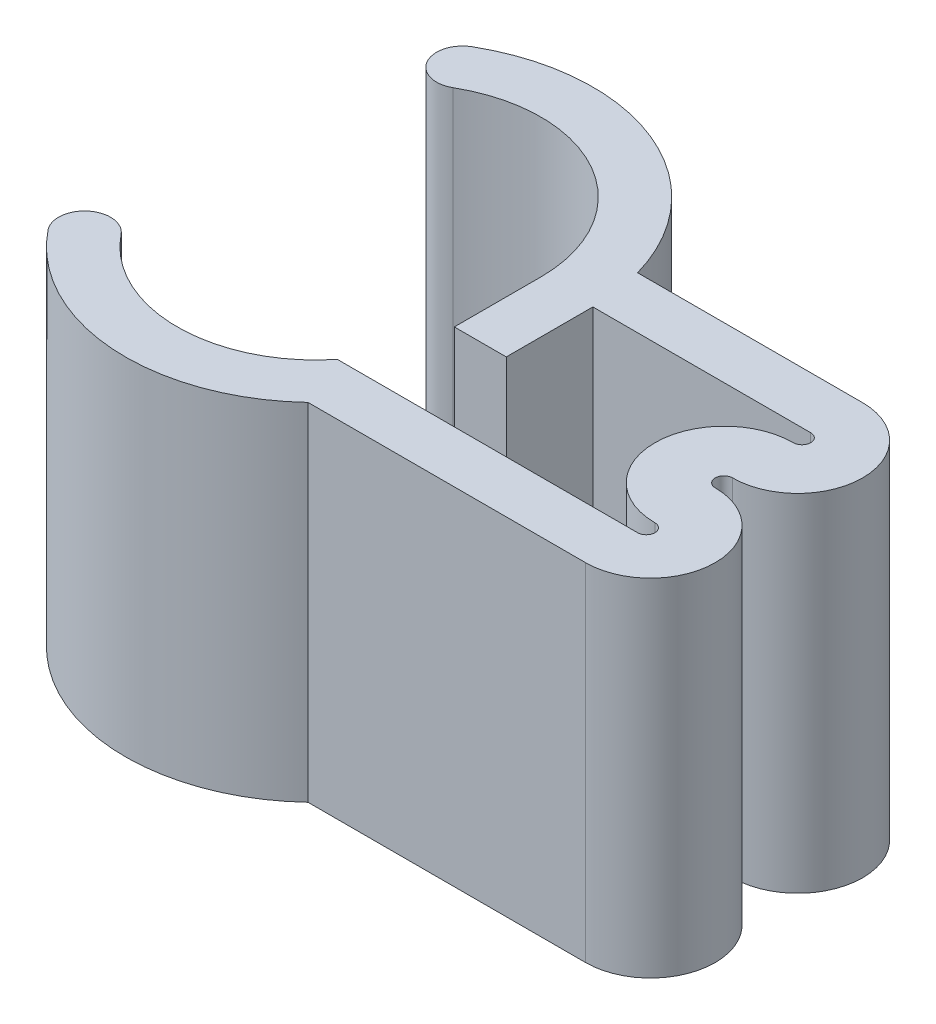
from build123d import *

# Parameters (mm, degrees)
BOSS_EXTRUDE1_DEPTH = 20


with BuildPart() as part:
    # Sketch1 → Boss-Extrude1 (new body)
    with BuildSketch(Plane(origin=(0, 0, 0), x_dir=(1, 0, 0), z_dir=(0, 1, 0))):
        with BuildLine():
            Line((3, 0), (15.583005244, 0))
            ThreePointArc((15.583005244, 0), (16.083005244, -0.5), (15.583005244, -1))
            ThreePointArc((15.583005244, -1), (11.583005244, -5), (15.583005244, -9))
            ThreePointArc((15.583005244, -9), (16.083005244, -9.5), (15.583005244, -10))
            Line((15.583005244, -10), (-1.755002002, -10))
            ThreePointArc((-1.755002002, -10), (-8, -13), (-14.244997998, -10))
            ThreePointArc((-14.244997998, -10), (-16.353435123, -9.766562875), (-16.586872248, -11.875))
            ThreePointArc((-16.586872248, -11.875), (-8.765028173, -15.973364657), (-0.450165565, -13))
            Line((-0.450165565, -13), (15.583005244, -13))
            ThreePointArc((15.583005244, -13), (19.324863957, -9.258141287), (15.583005244, -5.516282574))
            ThreePointArc((15.583005244, -5.516282574), (15.083005244, -5.016282574), (15.583005244, -4.516282574))
            ThreePointArc((15.583005244, -4.516282574), (19.341146531, -0.758141287), (15.583005244, 3))
            Line((15.583005244, 3), (2.583005244, 3))
            ThreePointArc((2.583005244, 3), (-3.863900821, 10.192776049), (-13.5, 9.526279442))
            ThreePointArc((-13.5, 9.526279442), (-14.049038106, 7.477241336), (-12, 6.92820323))
            ThreePointArc((-12, 6.92820323), (-4, 6.92820323), (0, 0))
            Line((0, 0), (0, -5))
            Line((0, -5), (3, -5))
            Line((3, -5), (3, 0))
        make_face()
    extrude(amount=BOSS_EXTRUDE1_DEPTH)


solid = part.part
